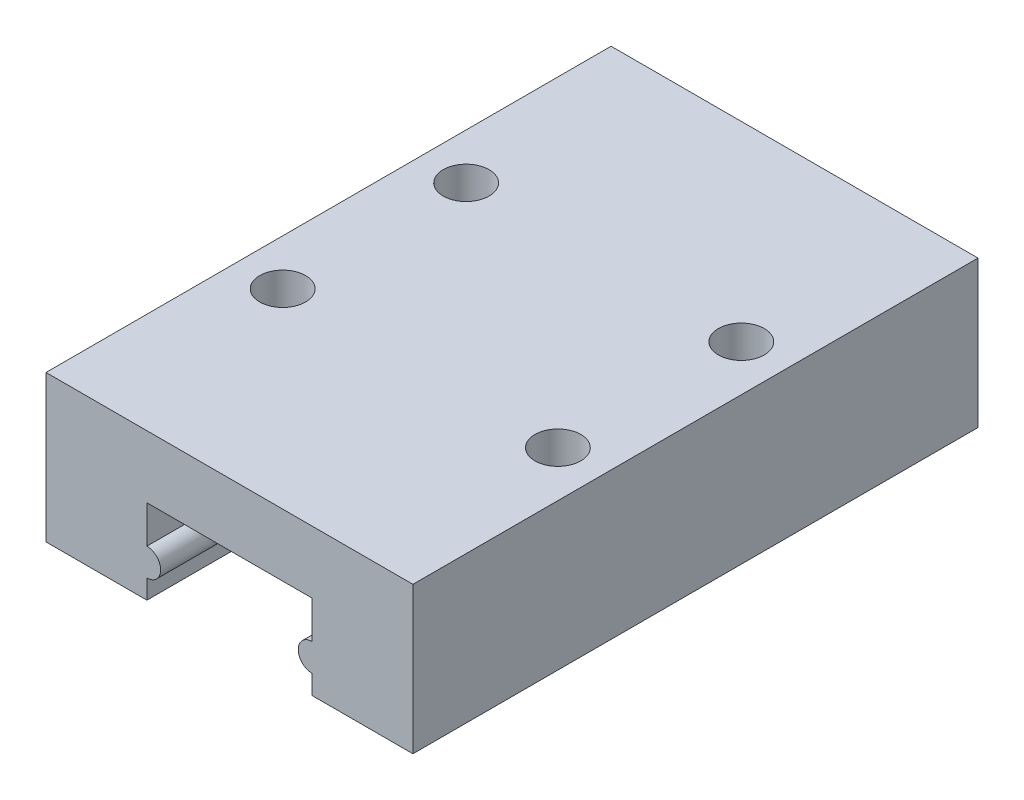
from build123d import *

# Parameters (mm, degrees)
EXTRUDE_1_DEPTH        = 30.8
SKETCH_2_R             = 1.25
CUT_EXTRUDE_1_DEPTH    = 4
HOLE_WIZARD_M3_1_D     = 2.5
HOLE_WIZARD_M3_1_DEPTH = 3
HOLE_WIZARD_M3_1_TIP   = 0.751075774


with BuildPart() as part:
    # 草图1 → 凸台-拉伸1 (new body)
    with BuildSketch(Plane.XY):
        with BuildLine():
            Line((-4.5, 0), (-4.5, 1.05))
            ThreePointArc((-4.5, 1.05), (-3.75, 1.8), (-4.5, 2.55))
            Line((-4.5, 2.55), (-4.5, 4.6))
            Line((-4.5, 4.6), (4.5, 4.6))
            Line((4.5, 4.6), (4.5, 2.55))
            ThreePointArc((4.5, 2.55), (3.75, 1.8), (4.5, 1.05))
            Line((4.5, 1.05), (4.5, 0))
            Line((4.5, 0), (10, 0))
            Line((10, 0), (10, 8))
            Line((10, 8), (-10, 8))
            Line((-10, 8), (-10, 0))
            Line((-10, 0), (-4.5, 0))
        make_face()
    extrude(amount=EXTRUDE_1_DEPTH)

    # 草图2 → 切除-拉伸1 (cut)
    with BuildSketch(Plane(origin=(0, 8, 0), x_dir=(1, 0, 0), z_dir=(0, 1, 0))):
        with Locations((-7.5, -10.4)):
            Circle(SKETCH_2_R)
        with Locations((7.5, -10.4)):
            Circle(SKETCH_2_R)
        with Locations((7.5, -20.4)):
            Circle(SKETCH_2_R)
        with Locations((-7.5, -20.4)):
            Circle(SKETCH_2_R)
    extrude(amount=-CUT_EXTRUDE_1_DEPTH, mode=Mode.SUBTRACT)

    # M3 螺纹孔1
    with Locations(Plane(origin=(-7.5, 8, 10.4), x_dir=(0, 0, 1), z_dir=(0, 1, 0))):
        with Locations((0, 0), (10, 0), (0, 15), (10, 15)):
            Hole(HOLE_WIZARD_M3_1_D / 2, depth=HOLE_WIZARD_M3_1_DEPTH)
            with Locations((0, 0, -(HOLE_WIZARD_M3_1_DEPTH + HOLE_WIZARD_M3_1_TIP / 2))):  # 118° drill point
                Cone(0, HOLE_WIZARD_M3_1_D / 2, HOLE_WIZARD_M3_1_TIP, mode=Mode.SUBTRACT)


solid = part.part
